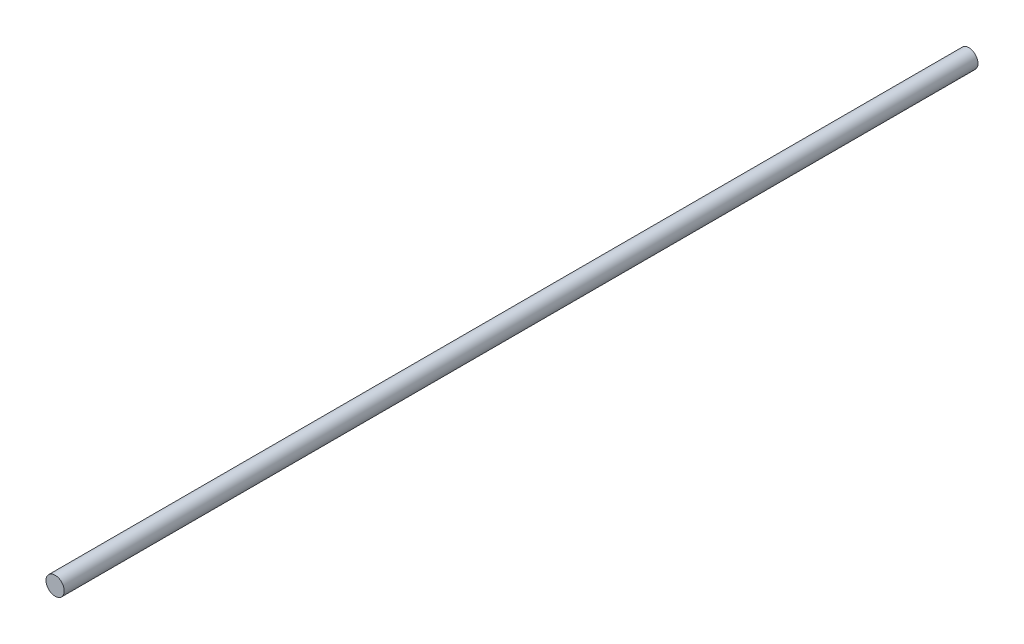
from build123d import *

# Parameters (mm, degrees)
SKETCH1_R           = 4
BOSS_EXTRUDE1_DEPTH = 400


with BuildPart() as part:
    # Sketch1 → Boss-Extrude1 (new body)
    with BuildSketch(Plane.XY):
        Circle(SKETCH1_R)
    extrude(amount=-BOSS_EXTRUDE1_DEPTH)


solid = part.part
